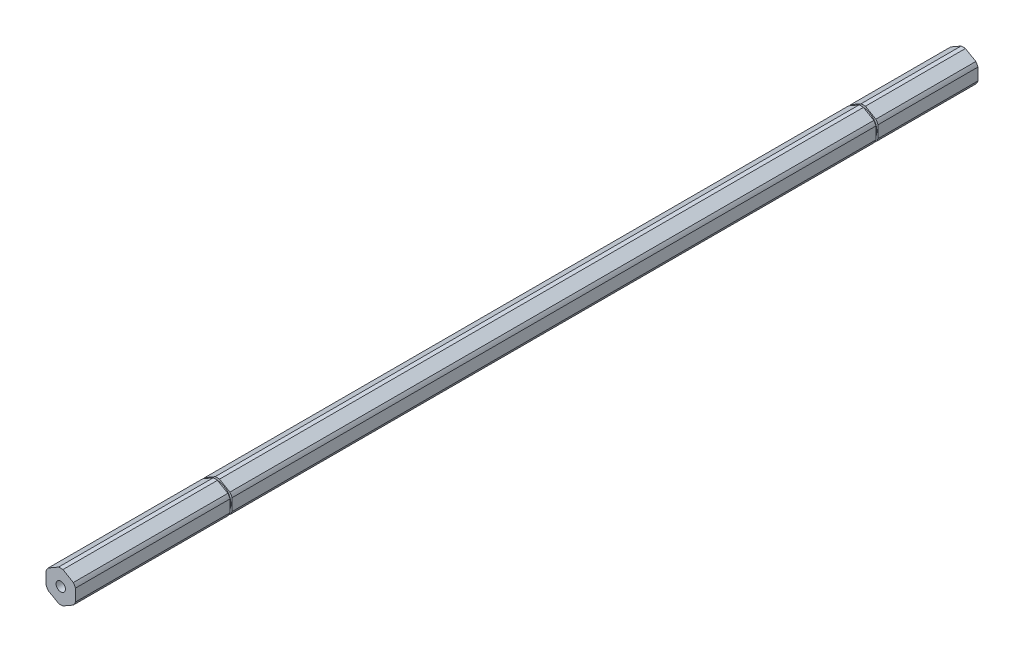
from build123d import *

# Parameters (mm, degrees)
BOSS_EXTRUDE1_DEPTH        = 194.32016
F_10_32_TAPPED_HOLE1_D     = 4.0386
F_10_32_TAPPED_HOLE1_DEPTH = 11.938
F_10_32_TAPPED_HOLE1_TIP   = 1.213317848
SKETCH6_R                  = 3.175
CUT_EXTRUDE2_DEPTH         = 12.065
SKETCH8_W                  = 3.175
SKETCH8_H                  = 0.889


with BuildPart() as part:
    # Sketch1 → Boss-Extrude1 (new, symmetric)
    with BuildSketch(Plane.XY):
        with BuildLine():
            ThreePointArc((0.93173274, 6.79441227), (0, 6.858), (-0.93173274, 6.79441227))
            Line((-0.93173274, 6.79441227), (-5.41826726, 4.204110358))
            ThreePointArc((-5.41826726, 4.204110358), (-5.939202219, 3.429), (-6.35, 2.590301913))
            Line((-6.35, 2.590301913), (-6.35, -2.590301913))
            ThreePointArc((-6.35, -2.590301913), (-5.939202219, -3.429), (-5.41826726, -4.204110358))
            Line((-5.41826726, -4.204110358), (-0.93173274, -6.79441227))
            ThreePointArc((-0.93173274, -6.79441227), (0, -6.858), (0.93173274, -6.79441227))
            Line((0.93173274, -6.79441227), (5.41826726, -4.204110358))
            ThreePointArc((5.41826726, -4.204110358), (5.939202219, -3.429), (6.35, -2.590301913))
            Line((6.35, -2.590301913), (6.35, 2.590301913))
            ThreePointArc((6.35, 2.590301913), (5.939202219, 3.429), (5.41826726, 4.204110358))
            Line((5.41826726, 4.204110358), (0.93173274, 6.79441227))
        make_face()
    extrude(amount=BOSS_EXTRUDE1_DEPTH, both=True)

    # #10-32 Tapped Hole1
    with Locations(Plane.XY.offset(194.32016)):
        with Locations((0, 0)):
            Hole(F_10_32_TAPPED_HOLE1_D / 2, depth=F_10_32_TAPPED_HOLE1_DEPTH)
            with Locations((0, 0, -(F_10_32_TAPPED_HOLE1_DEPTH + F_10_32_TAPPED_HOLE1_TIP / 2))):  # 118° drill point
                Cone(0, F_10_32_TAPPED_HOLE1_D / 2, F_10_32_TAPPED_HOLE1_TIP, mode=Mode.SUBTRACT)

    # Sketch6 → Cut-Extrude2 (cut)
    with BuildSketch(Plane(origin=(0, 0, -194.32016), x_dir=(-1, 0, 0), z_dir=(0, 0, -1))):
        Circle(SKETCH6_R)
    extrude(amount=-CUT_EXTRUDE2_DEPTH, mode=Mode.SUBTRACT)

    # Sketch8 → Cut-Revolve5 (revolve, cut)
    with BuildSketch(Plane(origin=(0, 0, 0), x_dir=(1, 0, 0), z_dir=(0, 1, 0))):
        with Locations((7.4422, 150.82266)):
            Rectangle(SKETCH8_W, SKETCH8_H)
        with Locations((7.4422, -127.32766)):
            Rectangle(SKETCH8_W, SKETCH8_H)
    revolve(axis=Axis((0, 0, -194.32016), (0, 0, 1)), mode=Mode.SUBTRACT)


solid = part.part
